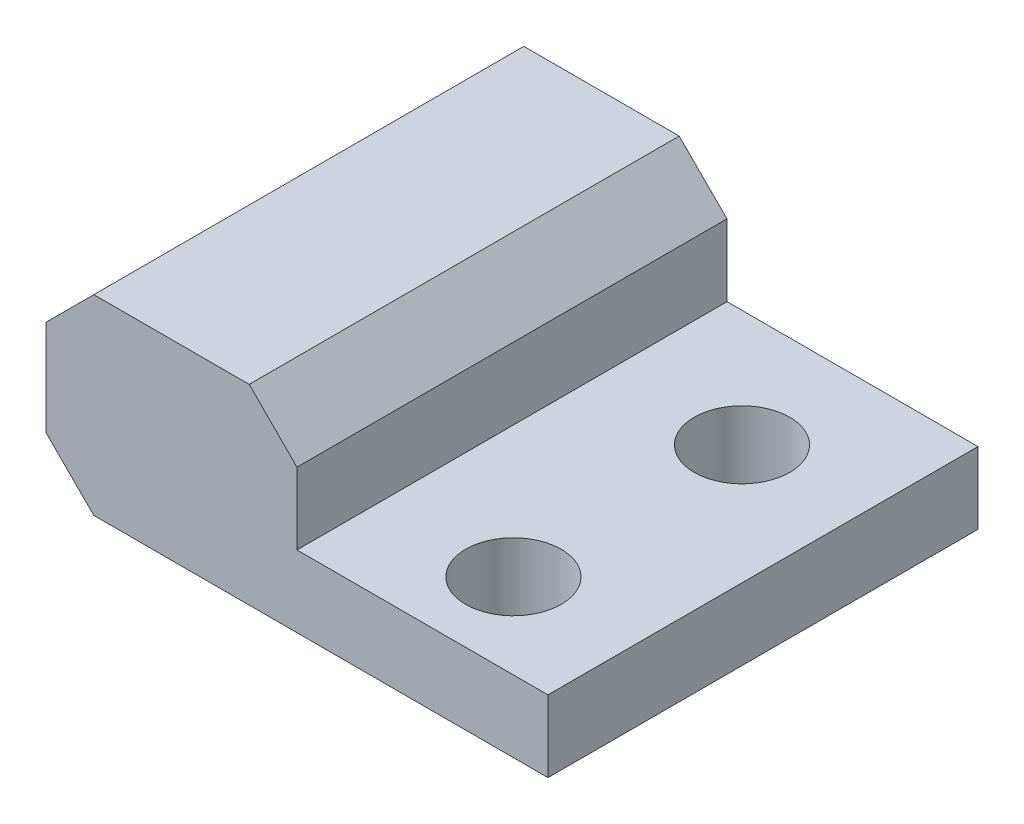
from build123d import *

# Parameters (mm, degrees)
SKETCH_1_W          = 21
SKETCH_1_H          = 17.990855805
EXTRUDE_1_DEPTH     = 8
SKETCH_2_W          = 10.499999995
SKETCH_2_H          = 17.994369167
CUT_EXTRUDE_1_DEPTH = 5
SKETCH_3_R          = 1.999999882
SKETCH_3_R_2        = 1.999999942
CUT_EXTRUDE_2_DEPTH = 22.671891763
SKETCH_4_R          = 2.6
CUT_EXTRUDE_3_DEPTH = 15
CHAMFER_1_SIZE      = 2


with BuildPart() as part:
    # Эскиз1 → Вытянуть1 (new body)
    with BuildSketch(Plane(origin=(0, 0, 0), x_dir=(1, 0, 0), z_dir=(0, 1, 0))):
        with Locations((-0.5, -8.995427903)):
            Rectangle(SKETCH_1_W, SKETCH_1_H)
    extrude(amount=EXTRUDE_1_DEPTH)

    # Эскиз2 → Вырез-Вытянуть1 (cut)
    with BuildSketch(Plane(origin=(0, 8, 0), x_dir=(1, 0, 0), z_dir=(0, 1, 0))):
        with Locations((4.749999998, -8.993671222)):
            Rectangle(SKETCH_2_W, SKETCH_2_H)
    extrude(amount=-CUT_EXTRUDE_1_DEPTH, mode=Mode.SUBTRACT)

    # Эскиз3 → Вырез-Вытянуть2 (cut, through all)
    with BuildSketch(Plane(origin=(0, 3, 0), x_dir=(1, 0, 0), z_dir=(0, 1, 0))):
        with Locations((4.999999995, -14.436118586)):
            Circle(SKETCH_3_R)
        with Locations((4.999999995, -4.873583798)):
            Circle(SKETCH_3_R_2)
    extrude(amount=-CUT_EXTRUDE_2_DEPTH, mode=Mode.SUBTRACT)

    # Эскиз4 → Вырез-Вытянуть3 (cut)
    with BuildSketch(Plane.XY):
        with Locations((-5.500000032, 4.090743194)):
            Circle(SKETCH_4_R)
    extrude(amount=CUT_EXTRUDE_3_DEPTH, mode=Mode.SUBTRACT)

    # Фаска1
    chamfer_1_edges = [part.edges().sort_by_distance(p)[0] for p in [
        (-0.5, 8, 8.995427902),
        (-11, 0, 8.995427902),
        (-11, 8, 8.995427902),
    ]]
    chamfer(chamfer_1_edges, length=CHAMFER_1_SIZE)


solid = part.part
